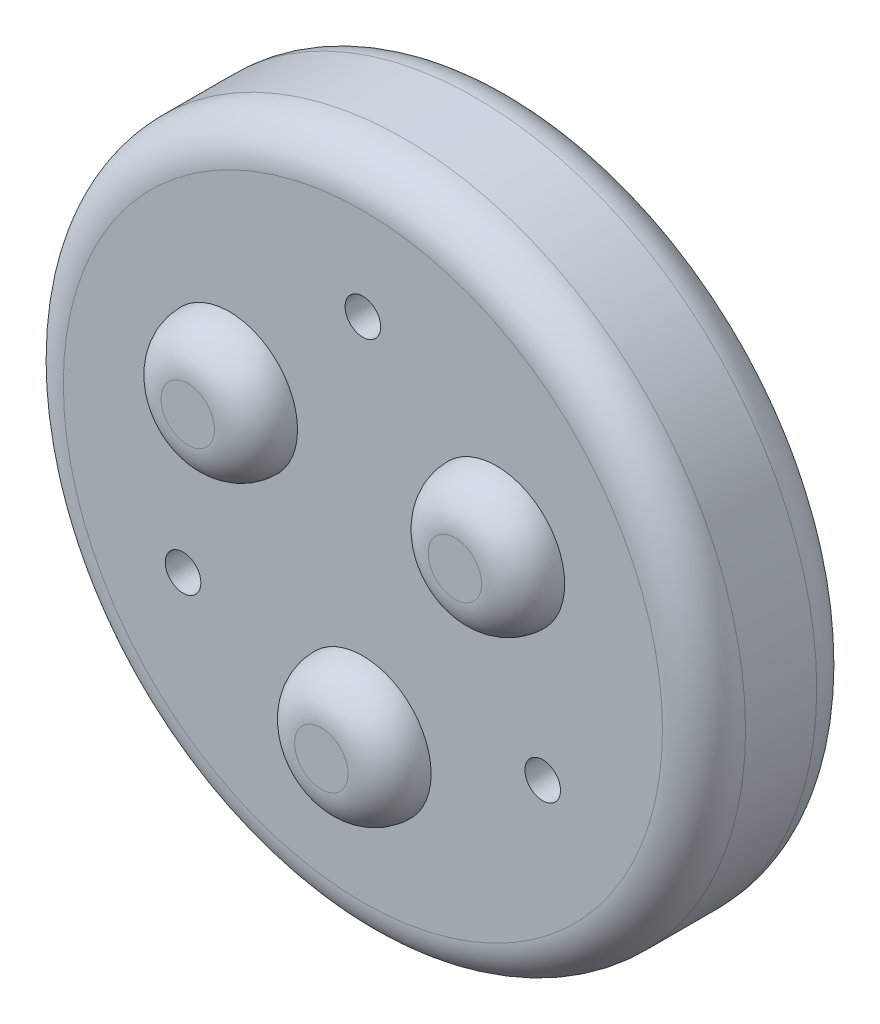
from build123d import *

# Parameters (mm, degrees)
SKETCH_1_R          = 57.5
EXTRUDE_1_DEPTH     = 26
FILLET_2_R          = 7
CUT_EXTRUDE_1_DEPTH = 8.5
SKETCH_3_R          = 1.5
CUT_EXTRUDE_3_DEPTH = 91.5
SKETCH_3_4_R        = 3
CUT_EXTRUDE_4_DEPTH = 14
CUT_EXTRUDE_START   = 15
SKETCH_3_6_R        = 3
CUT_EXTRUDE_5_DEPTH = 67
FILLET_10_R         = 3
FILLET_11_R         = 3
FILLET_12_R         = 3
FILLET_13_R         = 3
CUT_EXTRUDE_START_2 = 16
SKETCH_3_8_R        = 3
CUT_EXTRUDE_6_DEPTH = 10
EXTRUDE_START       = 26
SKETCH_3_21_R       = 11.5
EXTRUDE_3_DEPTH     = 7
FILLET_30_R         = 7
SKETCH_3_22_R       = 11.5
EXTRUDE_4_DEPTH     = 7
SKETCH_3_23_R       = 11.5
EXTRUDE_5_DEPTH     = 7
FILLET_32_R         = 7
FILLET_33_R         = 7


with BuildPart() as part:
    # Эскиз1 → Бобышка-Вытянуть1 (new body)
    with BuildSketch(Plane.XY):
        with Locations(Location((0, 0, 0), (0, 0, 180))):
            Circle(SKETCH_1_R)
    extrude(amount=EXTRUDE_1_DEPTH)

    # Скругление2
    fillet_2_edges = [part.edges().sort_by_distance(p)[0] for p in [
        (57.5, 0, 0),
        (57.5, 0, 26),
    ]]
    fillet(fillet_2_edges, radius=FILLET_2_R)

    # Эскиз2 → Вырез-Вытянуть1 (cut)
    with BuildSketch(Plane.XY):
        Polygon((0, 26), (-8, 26), (-8, 43), (8, 43), (8, 26), align=None)
    extrude(amount=CUT_EXTRUDE_1_DEPTH, mode=Mode.SUBTRACT)

    # Эскиз3 → Вырез-Вытянуть3 (cut)
    with BuildSketch(Plane.XY):
        with Locations((0, 35)):
            Circle(SKETCH_3_R)
    extrude(amount=CUT_EXTRUDE_3_DEPTH, mode=Mode.SUBTRACT)

    # Эскиз3<4> → Вырез-Вытянуть4 (cut)
    with BuildSketch(Plane.XY):
        with Locations((0, 35)):
            Circle(SKETCH_3_4_R)
    extrude(amount=CUT_EXTRUDE_4_DEPTH, mode=Mode.SUBTRACT)

    # Эскиз3<6> → Вырез-Вытянуть5 (cut)
    with BuildSketch(Plane.XY.offset(CUT_EXTRUDE_START)):
        with Locations((0, 35)):
            Circle(SKETCH_3_6_R)
    extrude(amount=CUT_EXTRUDE_5_DEPTH, mode=Mode.SUBTRACT)

    # Скругление10
    fillet_10_edges = [part.edges().sort_by_distance(p)[0] for p in [
        (8, 43, 4.25),
    ]]
    fillet(fillet_10_edges, radius=FILLET_10_R)

    # Скругление11
    fillet_11_edges = [part.edges().sort_by_distance(p)[0] for p in [
        (-8, 43, 4.25),
    ]]
    fillet(fillet_11_edges, radius=FILLET_11_R)

    # Скругление12
    fillet_12_edges = [part.edges().sort_by_distance(p)[0] for p in [
        (-8, 26, 4.25),
    ]]
    fillet(fillet_12_edges, radius=FILLET_12_R)

    # Скругление13
    fillet_13_edges = [part.edges().sort_by_distance(p)[0] for p in [
        (8, 26, 4.25),
    ]]
    fillet(fillet_13_edges, radius=FILLET_13_R)

    # Эскиз3<8> → Вырез-Вытянуть6 (cut)
    with BuildSketch(Plane.XY.offset(CUT_EXTRUDE_START_2)):
        with Locations((0, 35)):
            Circle(SKETCH_3_8_R)
        with Locations((30.310889132, -17.5)):
            Circle(SKETCH_3_8_R)
        with Locations((-30.310889132, -17.5)):
            Circle(SKETCH_3_8_R)
    extrude(amount=CUT_EXTRUDE_6_DEPTH, mode=Mode.SUBTRACT)

    # Эскиз3<21> → Бобышка-Вытянуть3 (add)
    with BuildSketch(Plane.XY.offset(EXTRUDE_START)):
        with Locations((-22.516660498, 13)):
            Circle(SKETCH_3_21_R)
    extrude(amount=EXTRUDE_3_DEPTH)

    # Скругление30
    fillet_30_edges = [part.edges().sort_by_distance(p)[0] for p in [
        (-34.016660498, 13, 33),
    ]]
    fillet(fillet_30_edges, radius=FILLET_30_R - 0.0001)  # a hair under: the kernel refuses the full size

    # Эскиз3<22> → Бобышка-Вытянуть4 (add)
    with BuildSketch(Plane.XY.offset(EXTRUDE_START)):
        with Locations((22.516660498, 13)):
            Circle(SKETCH_3_22_R)
    extrude(amount=EXTRUDE_4_DEPTH)

    # Эскиз3<23> → Бобышка-Вытянуть5 (add)
    with BuildSketch(Plane.XY.offset(EXTRUDE_START)):
        with Locations((0, -26)):
            Circle(SKETCH_3_23_R)
    extrude(amount=EXTRUDE_5_DEPTH)

    # Скругление32
    fillet_32_edges = [part.edges().sort_by_distance(p)[0] for p in [
        (11.016660498, 13, 33),
    ]]
    fillet(fillet_32_edges, radius=FILLET_32_R - 0.0001)  # a hair under: the kernel refuses the full size

    # Скругление33
    fillet_33_edges = [part.edges().sort_by_distance(p)[0] for p in [
        (-11.5, -26, 33),
    ]]
    fillet(fillet_33_edges, radius=FILLET_33_R - 0.0001)  # a hair under: the kernel refuses the full size


solid = part.part
